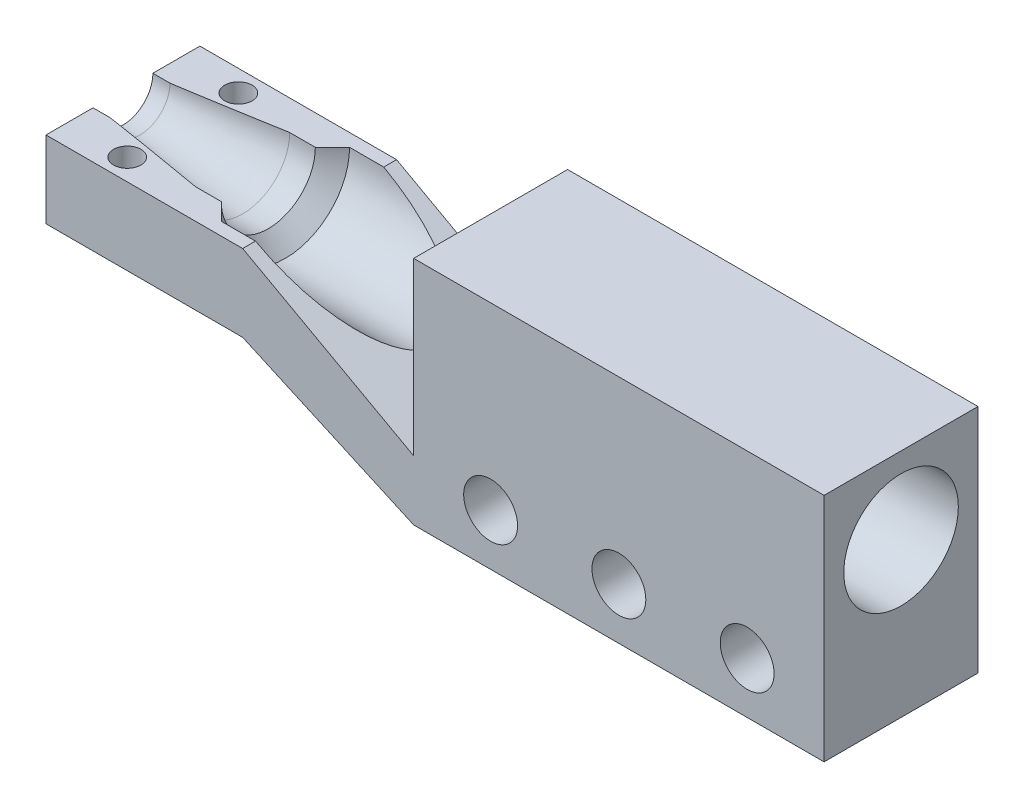
from build123d import *

# Parameters (mm, degrees)
SKETCH_1_W          = 48
SKETCH_1_H          = 18
EXTRUDE_1_DEPTH     = 3.5
SKETCH_6_W          = 18
SKETCH_6_H          = 9
EXTRUDE_4_DEPTH     = 23
SKETCH_7_R          = 3.5
CUT_EXTRUDE_1_DEPTH = 2
SKETCH_9_R          = 5.5
CUT_EXTRUDE_4_DEPTH = 3
CUT_EXTRUDE_5_REACH = 75.995
SKETCH_10_R         = 7.5
CUT_EXTRUDE_6_REACH = 71.957
SKETCH_11_R         = 1.6
EXTRUDE_5_OUTLINE_W = 48
EXTRUDE_5_OUTLINE_H = 18
EXTRUDE_5_DEPTH     = 20
CUT_EXTRUDE_7_REACH = 96.415
SKETCH_13_R         = 3.25
SKETCH_13_R_2       = 1
SKETCH_15_R         = 6.7
CUT_EXTRUDE_8_DEPTH = 45
SKETCH_16_R         = 3.15
CUT_EXTRUDE_9_DEPTH = 74.247867011


with BuildPart() as part:
    # 草圖1 → 填料-伸長1 (new, symmetric)
    with BuildSketch(Plane(origin=(0, 0, 0), x_dir=(1, 0, 0), z_dir=(0, 1, 0))):
        Rectangle(SKETCH_1_W, SKETCH_1_H)
    extrude(amount=EXTRUDE_1_DEPTH, both=True)

    # Sketch 3D_3 → Loft 1 section 0
    with BuildSketch(Plane(origin=(-44, 14.5, -9), x_dir=(0, -0.447213595499958, 0.894427190999916), z_dir=(-1, 0, 0))):
        with BuildLine():
            Line((0, 0), (16.099689438, 8.049844719))
            Line((16.099689438, 8.049844719), (20.124611797, 0))
            Line((20.124611797, 0), (4.024922359, -8.049844719))
            Line((4.024922359, -8.049844719), (0, 0))
        make_face()
    # 草圖5 → Loft 1 section 1
    with BuildSketch(Plane.ZY.offset(24)):
        with BuildLine():
            Line((-9, 3.5), (9, 3.5))
            Line((9, 3.5), (9, -3.5))
            Line((9, -3.5), (-9, -3.5))
            Line((-9, -3.5), (-9, 3.5))
        make_face()
    loft()

    # 草圖6 → 填料-伸長4 (add)
    with BuildSketch(Plane.ZY.offset(44)):
        with Locations((0, 10)):
            Rectangle(SKETCH_6_W, SKETCH_6_H)
    extrude(amount=EXTRUDE_4_DEPTH)

    # 草圖7 → 除料-伸長1 (cut)
    with BuildSketch(Plane.ZY.offset(67)):
        with Locations((0, 14.5)):
            Circle(SKETCH_7_R)
    extrude(amount=-CUT_EXTRUDE_1_DEPTH, mode=Mode.SUBTRACT)

    # Loft 1 2: read off the stored shape, not the designer's step
    # Loft 1 2: loft between two sections, ruled curve by curve
    loft_1_2_from = [
        Edge.make_bspline([(-65, 14.5, 3.5), (-65, 12.75, 3.5), (-65, 11, 2.333333333), (-65, 11, -2.333333333), (-65, 12.75, -3.5), (-65, 14.5, -3.5)], [0, 0, 0, 0, 0.5, 0.5, 1, 1, 1, 1], 3, [1, 0.666666667, 0.5, 0.5, 0.666666667, 1]),
        Edge.make_line((-65, 14.5, -3.5), (-65, 14.5, 3.5)),
    ]
    loft_1_2_to = [
        Edge.make_bspline([(-53, 15.833945938, 5.335783751), (-53, 12.063417219, 6.27841593), (-53, 9, 3.886572043), (-53, 9, -3.886572043), (-53, 12.063417219, -6.27841593), (-53, 15.833945938, -5.335783751)], [0, 0, 0, 0, 0.5, 0.5, 1, 1, 1, 1], 3, [1, 0.552953065, 0.4111804, 0.4111804, 0.552953065, 1]),
        Edge.make_line((-53, 15.833945938, -5.335783751), (-53, 15.833945938, 5.335783751)),
    ]
    loft_1_2 = Solid(Shell([*[Face.make_surface_from_curves(loft_1_2_from[k], loft_1_2_to[k]) for k in range(2)], Face(Wire(loft_1_2_from)), Face(Wire(loft_1_2_to))]))
    add(loft_1_2, mode=Mode.SUBTRACT)

    # 草圖9 → 除料-伸長4 (cut)
    with BuildSketch(Plane.ZY.offset(53)):
        with Locations((3.554e-06, 14.500000002)):
            Circle(SKETCH_9_R)
    extrude(amount=-CUT_EXTRUDE_4_DEPTH, mode=Mode.SUBTRACT)

    # 除料-疊層拉伸4: read off the stored shape, not the designer's step
    # 除料-疊層拉伸4: loft between two sections, ruled curve by curve
    loft_4_from = [
        Edge.make_bspline([(-50, 14.5, 5.500003554), (-50, 11.750000001, 5.500003553), (-50, 9.000000002, 3.66667022), (-50, 9.000000002, -3.666663111), (-50, 11.750000001, -5.499996445), (-50, 14.5, -5.499996446)], [0, 0, 0, 0, 0.5, 0.5, 1, 1, 1, 1], 3, [1, 0.666666667, 0.5, 0.5, 0.666666667, 1]),
        Edge.make_line((-50, 14.5, -5.499996446), (-50, 14.5, 5.500003554)),
    ]
    loft_4_to = [
        Edge.make_bspline([(-48, 16.319017189, 7.276072306), (-48, 11.177387119, 8.561479823), (-48, 7.000000002, 5.299874521), (-48, 7.000000002, -5.299867413), (-48, 11.177387119, -8.561472714), (-48, 16.319017189, -7.276065197)], [0, 0, 0, 0, 0.5, 0.5, 1, 1, 1, 1], 3, [1, 0.552953065, 0.4111804, 0.4111804, 0.552953065, 1]),
        Edge.make_line((-48, 16.319017189, -7.276065197), (-48, 16.319017189, 7.276072306)),
    ]
    loft_4 = Solid(Shell([*[Face.make_surface_from_curves(loft_4_from[k], loft_4_to[k]) for k in range(2)], Face(Wire(loft_4_from)), Face(Wire(loft_4_to))]))
    add(loft_4, mode=Mode.SUBTRACT)

    # 草圖10 → 除料-伸長5 (cut, up to next)
    with BuildSketch(Plane.ZY.offset(48), mode=Mode.PRIVATE) as cut_extrude_5_sk1:
        with Locations((4.786e-06, 14.500000002)):
            Circle(SKETCH_10_R)
    cut_extrude_5_tool1 = extrude(cut_extrude_5_sk1.sketch, amount=-CUT_EXTRUDE_5_REACH, mode=Mode.PRIVATE) & part.part
    add(cut_extrude_5_tool1.solids().sort_by_distance((-48, 14.5, 5e-06))[0], mode=Mode.SUBTRACT)

    # 草圖11 → 除料-伸長6 (cut, up to next)
    with BuildSketch(Plane(origin=(0, 14.5, 0), x_dir=(1, 0, 0), z_dir=(0, 1, 0)), mode=Mode.PRIVATE) as cut_extrude_6_sk1:
        with Locations(Location((-60, -6.5, 0), (0, 0, 270))):
            Circle(SKETCH_11_R)
    cut_extrude_6_tool1 = extrude(cut_extrude_6_sk1.sketch, amount=-CUT_EXTRUDE_6_REACH, mode=Mode.PRIVATE) & part.part
    # 草圖11 → 除料-伸長6 (cut, up to next)
    with BuildSketch(Plane(origin=(0, 14.5, 0), x_dir=(1, 0, 0), z_dir=(0, 1, 0)), mode=Mode.PRIVATE) as cut_extrude_6_sk2:
        with Locations(Location((-60, 6.5, 0), (0, 0, 270))):
            Circle(SKETCH_11_R)
    cut_extrude_6_tool2 = extrude(cut_extrude_6_sk2.sketch, amount=-CUT_EXTRUDE_6_REACH, mode=Mode.PRIVATE) & part.part
    add(cut_extrude_6_tool1.solids().sort_by_distance((-60, 14.5, 6.5))[0], mode=Mode.SUBTRACT)
    add(cut_extrude_6_tool2.solids().sort_by_distance((-60, 14.5, -6.5))[0], mode=Mode.SUBTRACT)

    # 填料-伸長5: read off the stored shape, not the designer's step
    # 填料-伸長5 outline → 填料-伸長5 (add)
    with BuildSketch(Plane(origin=(0, 3.5, 0), x_dir=(1, 0, 0), z_dir=(0, 1, 0))):
        Rectangle(EXTRUDE_5_OUTLINE_W, EXTRUDE_5_OUTLINE_H)
    extrude(amount=EXTRUDE_5_DEPTH)

    # 草圖13 → 除料-伸長7 (cut, up to next)
    with BuildSketch(Plane.ZY.offset(-24), mode=Mode.PRIVATE) as cut_extrude_7_sk1:
        with Locations(Location((0, 14.5, 0), (0, 0, 180))):
            Circle(SKETCH_13_R)
    cut_extrude_7_tool1 = extrude(cut_extrude_7_sk1.sketch, amount=CUT_EXTRUDE_7_REACH, mode=Mode.PRIVATE) & part.part
    # 草圖13 → 除料-伸長7 (cut, up to next)
    with BuildSketch(Plane.ZY.offset(-24), mode=Mode.PRIVATE) as cut_extrude_7_sk2:
        with Locations(Location((-4.75, 14.5, 0), (0, 0, 180))):
            Circle(SKETCH_13_R_2)
    cut_extrude_7_tool2 = extrude(cut_extrude_7_sk2.sketch, amount=CUT_EXTRUDE_7_REACH, mode=Mode.PRIVATE) & part.part
    # 草圖13 → 除料-伸長7 (cut, up to next)
    with BuildSketch(Plane.ZY.offset(-24), mode=Mode.PRIVATE) as cut_extrude_7_sk3:
        with Locations(Location((4.75, 14.5, 0), (0, 0, 180))):
            Circle(SKETCH_13_R_2)
    cut_extrude_7_tool3 = extrude(cut_extrude_7_sk3.sketch, amount=CUT_EXTRUDE_7_REACH, mode=Mode.PRIVATE) & part.part
    add(cut_extrude_7_tool1.solids().sort_by_distance((24, 14.5, 0))[0], mode=Mode.SUBTRACT)
    add(cut_extrude_7_tool2.solids().sort_by_distance((24, 14.5, -4.75))[0], mode=Mode.SUBTRACT)
    add(cut_extrude_7_tool3.solids().sort_by_distance((24, 14.5, 4.75))[0], mode=Mode.SUBTRACT)

    # 草圖15 → 除料-伸長8 (cut)
    with BuildSketch(Plane(origin=(24, 0, 0), x_dir=(0, 0, -1), z_dir=(1, 0, 0))):
        with Locations((0, 14.5)):
            Circle(SKETCH_15_R)
    extrude(amount=-CUT_EXTRUDE_8_DEPTH, mode=Mode.SUBTRACT)

    # 草圖16 → 除料-伸長9 (cut, through all)
    with BuildSketch(Plane.XY.offset(9)):
        with Locations((15, 2.5)):
            Circle(SKETCH_16_R)
        with Locations((0, 2.5)):
            Circle(SKETCH_16_R)
        with Locations((-15, 2.5)):
            Circle(SKETCH_16_R)
    extrude(amount=-CUT_EXTRUDE_9_DEPTH, mode=Mode.SUBTRACT)


solid = part.part
